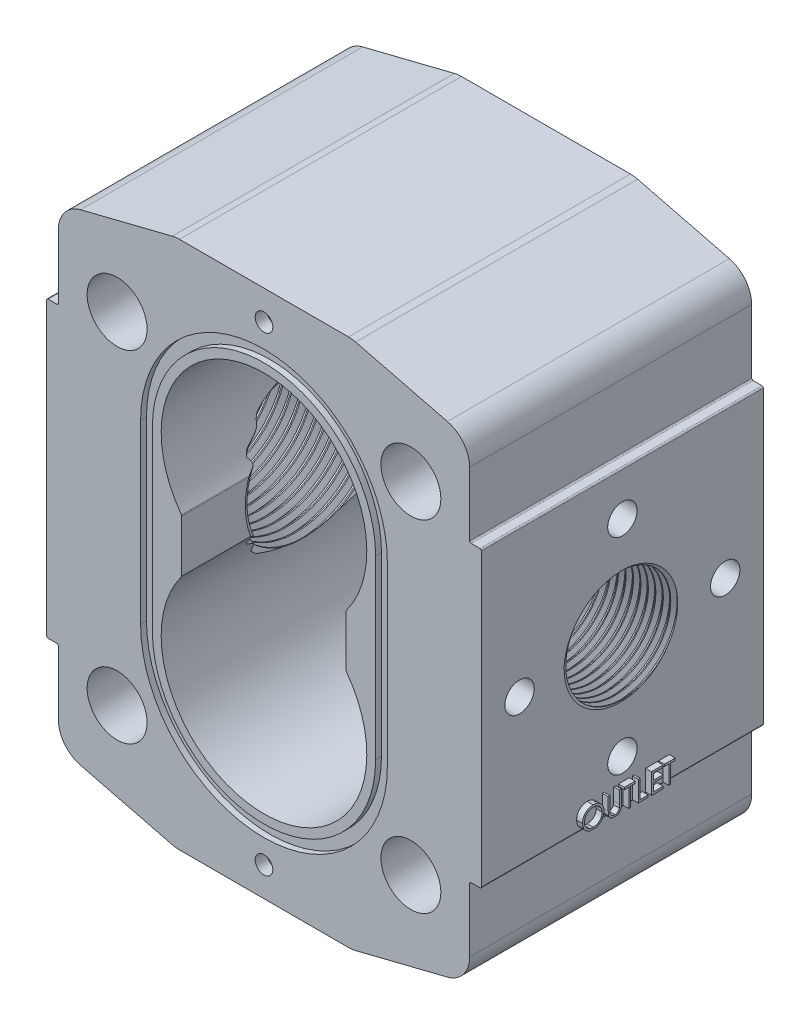
from build123d import *

# Parameters (mm, degrees)
BOSS_EXTRUDE1_DEPTH              = 24
FILLET1_R                        = 5
FILLET2_R                        = 0.25
F_10_2_10_2_DIAMETER_HOLE1_D     = 10.2
F_18_5_18_5_DIAMETER_HOLE1_D     = 18.5
F_18_5_18_5_DIAMETER_HOLE1_DEPTH = 23
F_25_0_25_DIAMETER_HOLE1_D       = 25
F_25_0_25_DIAMETER_HOLE1_DEPTH   = 23
CUT_EXTRUDE_THIN1_DEPTH          = 1
SKETCH10_3_R                     = 1.5
CUT_EXTRUDE1_DEPTH               = 2
WRAP1_DEPTH                      = 1
WRAP2_OUTLINE_W                  = 0.314102564
WRAP2_OUTLINE_H                  = 3.5
WRAP2_DEPTH                      = 1
THREAD1_PITCH                    = 1.27
THREAD2_PITCH                    = 1.5875


# Read off the part's stored shape, not the designer's step: Ø5.0 (5) Diameter Hole1, Wrap1, Wrap2
with BuildPart() as part:
    # Sketch1 → Boss-Extrude1 (new, symmetric)
    with BuildSketch(Plane.XY):
        Polygon((35, -25), (37, -25), (37, 25), (35, 25), (35, 40), (15, 45), (-15, 45), (-35, 40), (-35, 25), (-37, 25), (-37, -25), (-35, -25), (-35, -40), (-15, -45), (15, -45), (35, -40), align=None)
        with BuildLine():
            Line((-14, -4.5), (-14, 4.5))
            ThreePointArc((-14, 4.5), (0, 32.5), (14, 4.5))
            Line((14, 4.5), (14, -4.5))
            ThreePointArc((14, -4.5), (0, -32.5), (-14, -4.5))
        make_face(mode=Mode.SUBTRACT)
    extrude(amount=BOSS_EXTRUDE1_DEPTH, both=True)

    # Fillet1
    fillet1_edges = [part.edges().sort_by_distance(p)[0] for p in [
        (35, -40, 0),
        (15, -45, 0),
        (-15, -45, 0),
        (-35, -40, 0),
        (-35, 40, 0),
        (-15, 45, 0),
        (15, 45, 0),
        (35, 40, 0),
    ]]
    fillet(fillet1_edges, radius=FILLET1_R)

    # Fillet2
    fillet2_edges = [part.edges().sort_by_distance(p)[0] for p in [
        (37, 25, 0),
        (37, -25, 0),
        (35, -25, 0),
        (-35, -25, 0),
        (-37, -25, 0),
        (-37, 25, 0),
        (-35, 25, 0),
        (35, 25, 0),
        (-14, 4.5, 0),
        (14, 4.5, 0),
        (14, -4.5, 0),
        (-14, -4.5, 0),
    ]]
    fillet(fillet2_edges, radius=FILLET2_R)

    # Ø10.2 (10.2) Diameter Hole1 (through all)
    with Locations(Plane.XY.offset(24)):
        with Locations((-25, 29), (25, 29), (25, -29), (-25, -29)):
            Hole(F_10_2_10_2_DIAMETER_HOLE1_D / 2)

    # Ø5.0 (5) Diameter Hole1 outline → Ø5.0 (5) Diameter Hole1 (revolve, cut)
    with BuildSketch(Plane.YX.offset(-17.5)):
        Polygon((0, 37), (0, 27), (2.5, 28.502151548), (2.5, 37), align=None)
    f_5_0_5_diameter_hole1 = revolve(axis=Axis((0, 0, 17.5), (1, 0, 0)), mode=Mode.SUBTRACT)

    # 5.0 _5_ Diameter Hole1 2 outline → 5.0 _5_ Diameter Hole1 2 (revolve, cut)
    with BuildSketch(Plane(origin=(0, 17.5, 0), x_dir=(0, 1, 0), z_dir=(0, 0, -1))):
        Polygon((0, 37), (0, 27), (2.5, 28.502151548), (2.5, 37), align=None)
    f_5_0_5_diameter_hole1_2 = revolve(axis=Axis((0, 17.5, 0), (1, 0, 0)), mode=Mode.SUBTRACT)

    # 5.0 _5_ Diameter Hole1 3 outline → 5.0 _5_ Diameter Hole1 3 (revolve, cut)
    with BuildSketch(Plane.YX.offset(17.5)):
        Polygon((0, 37), (0, 27), (2.5, 28.502151548), (2.5, 37), align=None)
    f_5_0_5_diameter_hole1_3 = revolve(axis=Axis((0, 0, -17.5), (1, 0, 0)), mode=Mode.SUBTRACT)

    # 5.0 _5_ Diameter Hole1 4 outline → 5.0 _5_ Diameter Hole1 4 (revolve, cut)
    with BuildSketch(Plane(origin=(0, -17.5, 0), x_dir=(0, 1, 0), z_dir=(0, 0, -1))):
        Polygon((0, 37), (0, 27), (2.5, 28.502151548), (2.5, 37), align=None)
    f_5_0_5_diameter_hole1_4 = revolve(axis=Axis((0, -17.5, 0), (1, 0, 0)), mode=Mode.SUBTRACT)

    # Ø18.5 (18.5) Diameter Hole1
    with Locations(Plane.YZ.offset(37)):
        with Locations((0, 0)):
            Hole(F_18_5_18_5_DIAMETER_HOLE1_D / 2, depth=F_18_5_18_5_DIAMETER_HOLE1_DEPTH)

    # Ø25.0 (25) Diameter Hole1
    with Locations(Plane.ZY.offset(37)):
        with Locations((0, 0)):
            Hole(F_25_0_25_DIAMETER_HOLE1_D / 2, depth=F_25_0_25_DIAMETER_HOLE1_DEPTH)

    # Mirror1: Ø5.0 (5) Diameter Hole1, 5.0 _5_ Diameter Hole1 2, 5.0 _5_ Diameter Hole1 3, 5.0 _5_ Diameter Hole1 4 across plane
    add(f_5_0_5_diameter_hole1.mirror(Plane(origin=(0, 0, 0), x_dir=(0, 0, 1), z_dir=(1, 0, 0))), mode=Mode.SUBTRACT)
    add(f_5_0_5_diameter_hole1_2.mirror(Plane(origin=(0, 0, 0), x_dir=(0, 0, 1), z_dir=(1, 0, 0))), mode=Mode.SUBTRACT)
    add(f_5_0_5_diameter_hole1_3.mirror(Plane(origin=(0, 0, 0), x_dir=(0, 0, 1), z_dir=(1, 0, 0))), mode=Mode.SUBTRACT)
    add(f_5_0_5_diameter_hole1_4.mirror(Plane(origin=(0, 0, 0), x_dir=(0, 0, 1), z_dir=(1, 0, 0))), mode=Mode.SUBTRACT)

    # Sketch10 → Cut-Extrude-Thin1 (cut)
    with BuildSketch(Plane.XY.offset(24)):
        with BuildLine():
            Line((21, 15), (21, -15))
            ThreePointArc((21, -15), (0, -36), (-21, -15))
            Line((-21, -15), (-21, 15))
            ThreePointArc((-21, 15), (0, 36), (21, 15))
        make_face()
        with BuildLine():
            Line((19, 15), (19, -15))
            ThreePointArc((19, -15), (0, -34), (-19, -15))
            Line((-19, -15), (-19, 15))
            ThreePointArc((-19, 15), (0, 34), (19, 15))
        make_face(mode=Mode.SUBTRACT)
    cut_extrude_thin1 = extrude(amount=-CUT_EXTRUDE_THIN1_DEPTH, mode=Mode.SUBTRACT)

    # Sketch10<3> → Cut-Extrude1 (cut)
    with BuildSketch(Plane.XY.offset(24)):
        with Locations((0, 40)):
            Circle(SKETCH10_3_R)
        with Locations(Location((0, -40, 0), (0, 0, 180))):
            Circle(SKETCH10_3_R)
    cut_extrude1 = extrude(amount=-CUT_EXTRUDE1_DEPTH, mode=Mode.SUBTRACT)

    # Mirror2: Cut-Extrude-Thin1, Cut-Extrude1 across plane
    add(cut_extrude_thin1.mirror(Plane.XY), mode=Mode.SUBTRACT)
    add(cut_extrude1.mirror(Plane.XY), mode=Mode.SUBTRACT)

    # Wrap1 outline → Wrap1 (add)
    # profile 1 of 6: a face of its own
    with BuildSketch(Plane(origin=(37, 0, 0), x_dir=(0, 0, -1), z_dir=(1, 0, 0))):
        with BuildLine():
            add(Edge.make_bspline(
                [(-4.128205128, -22.998597756), (-4.146214493, -22.783332931), (-4.182215554, -22.353014461), (-4.554460876, -21.743273271), (-5.167773034, -21.246562805), (-5.716123192, -21.189031248), (-5.990384615, -21.16025641)],
                knots=[0, 0, 0, 0, 0.220428897, 0.440641545, 0.720232695, 1, 1, 1, 1], degree=3))
            add(Edge.make_bspline(
                [(-5.990384615, -21.16025641), (-6.202587591, -21.181412289), (-6.627026427, -21.223727326), (-7.23171843, -21.590241007), (-7.710726501, -22.205388246), (-7.775365163, -22.74536902), (-7.807692308, -23.015424679)],
                knots=[0, 0, 0, 0, 0.220319519, 0.440673179, 0.720268979, 1, 1, 1, 1], degree=3))
            add(Edge.make_bspline(
                [(-7.807692308, -23.015424679), (-7.755908335, -23.350070613), (-7.670876964, -23.899572725), (-7.140234589, -24.483431158), (-6.752544953, -24.661174467), (-6.558800732, -24.75)],
                knots=[0, 0, 0, 0, 0.437940623, 0.719116155, 1, 1, 1, 1], degree=3))
            Line((-6.558800732, -24.75), (-5.372547444, -24.75))
            add(Edge.make_bspline(
                [(-5.372547444, -24.75), (-5.073423249, -24.589796508), (-4.582568358, -24.326906815), (-4.18483573, -23.640580386), (-4.147087316, -23.212652281), (-4.128205128, -22.998597756)],
                knots=[0, 0, 0, 0, 0.438118142, 0.718940279, 1, 1, 1, 1], degree=3))
        make_face()
        with BuildLine():
            add(Edge.make_bspline(
                [(-5.974959936, -21.519230769), (-5.801087777, -21.536368215), (-5.453216234, -21.570655646), (-4.948847463, -21.849397066), (-4.522950191, -22.33131773), (-4.469190634, -22.775686239), (-4.442307692, -22.997896635)],
                knots=[0, 0, 0, 0, 0.220484161, 0.441129654, 0.72053195, 1, 1, 1, 1], degree=3))
            add(Edge.make_bspline(
                [(-4.442307692, -22.997896635), (-4.458400012, -23.172803057), (-4.490578711, -23.522551327), (-4.79339563, -24.021509922), (-5.30832212, -24.404798431), (-5.752675754, -24.455437474), (-5.974959936, -24.480769231)],
                knots=[0, 0, 0, 0, 0.220346167, 0.440610981, 0.720170331, 1, 1, 1, 1], degree=3))
            add(Edge.make_bspline(
                [(-5.974959936, -24.480769231), (-6.148126777, -24.466558032), (-6.49436589, -24.438143396), (-6.990234844, -24.151542085), (-7.413239581, -23.675907239), (-7.466814168, -23.234586352), (-7.493589744, -23.014022436)],
                knots=[0, 0, 0, 0, 0.220521963, 0.440923494, 0.72058403, 1, 1, 1, 1], degree=3))
            add(Edge.make_bspline(
                [(-7.493589744, -23.014022436), (-7.42323413, -22.66722226), (-7.30747657, -22.096624696), (-6.632603875, -21.60634569), (-6.194149646, -21.548265773), (-5.974959936, -21.519230769)],
                knots=[0, 0, 0, 0, 0.436600851, 0.718348488, 1, 1, 1, 1], degree=3))
        make_face(mode=Mode.SUBTRACT)
    # profile 2 of 6: a face of its own
    with BuildSketch(Plane(origin=(37, 0, 0), x_dir=(0, 0, -1), z_dir=(1, 0, 0))):
        with BuildLine():
            Line((-1.480769231, -21.25), (-1.480769231, -23.347055288))
            add(Edge.make_bspline(
                [(-1.480769231, -23.347055288), (-1.480408624, -23.427156357), (-1.479589764, -23.60904898), (-1.503272823, -23.789461453), (-1.516526442, -23.890424679)],
                knots=[0, 0, 0, 0, 0.440375572, 1, 1, 1, 1], degree=3))
            add(Edge.make_bspline(
                [(-1.516526442, -23.890424679), (-1.5779401, -24.036202146), (-1.71681475, -24.365848605), (-2.072976193, -24.43962083), (-2.271634615, -24.480769231)],
                knots=[0, 0, 0, 0, 0.442223668, 1, 1, 1, 1], degree=3))
            add(Edge.make_bspline(
                [(-2.271634615, -24.480769231), (-2.439979461, -24.453325866), (-2.715562492, -24.408400668), (-3.015417869, -24.133220542), (-3.059859408, -23.919637767), (-3.08213141, -23.81260016)],
                knots=[0, 0, 0, 0, 0.439179343, 0.718943156, 1, 1, 1, 1], degree=3))
            add(Edge.make_bspline(
                [(-3.08213141, -23.81260016), (-3.086673127, -23.744421406), (-3.096998129, -23.589425866), (-3.096456965, -23.434072501), (-3.096153846, -23.347055288)],
                knots=[0, 0, 0, 0, 0.439875587, 1, 1, 1, 1], degree=3))
            Line((-3.096153846, -23.347055288), (-3.096153846, -21.25))
            Line((-3.096153846, -21.25), (-3.41025641, -21.25))
            Line((-3.41025641, -21.25), (-3.41025641, -23.363882212))
            add(Edge.make_bspline(
                [(-3.41025641, -23.363882212), (-3.410259313, -23.472899755), (-3.410265902, -23.720384869), (-3.370247057, -23.964743842), (-3.347856571, -24.10146234)],
                knots=[0, 0, 0, 0, 0.440501419, 1, 1, 1, 1], degree=3))
            add(Edge.make_bspline(
                [(-3.347856571, -24.10146234), (-3.295315608, -24.227818542), (-3.176089385, -24.514546689), (-2.901665215, -24.665544402), (-2.748175094, -24.75)],
                knots=[0, 0, 0, 0, 0.440682938, 1, 1, 1, 1], degree=3))
            Line((-2.748175094, -24.75), (-1.811583713, -24.75))
            add(Edge.make_bspline(
                [(-1.811583713, -24.75), (-1.613372069, -24.605339259), (-1.287236407, -24.367315772), (-1.180035847, -23.815751804), (-1.171128463, -23.514688016), (-1.166666667, -23.363882212)],
                knots=[0, 0, 0, 0, 0.436084207, 0.717529047, 1, 1, 1, 1], degree=3))
            Line((-1.166666667, -23.363882212), (-1.166666667, -21.25))
            Line((-1.166666667, -21.25), (-1.480769231, -21.25))
        make_face()
    # profile 3 of 6: a face of its own
    with BuildSketch(Plane(origin=(37, 0, 0), x_dir=(0, 0, -1), z_dir=(1, 0, 0))):
        Polygon((0.08974359, -24.75), (0.403846154, -24.75), (0.403846154, -21.608974359), (1.166666667, -21.608974359), (1.166666667, -21.25), (-0.673076923, -21.25), (-0.673076923, -21.608974359), (0.08974359, -21.608974359), align=None)
    # profile 4 of 6: a face of its own
    with BuildSketch(Plane(origin=(37, 0, 0), x_dir=(0, 0, -1), z_dir=(1, 0, 0))):
        Polygon((1.705128205, -24.75), (3.365384615, -24.75), (3.365384615, -24.391025641), (2.019230769, -24.391025641), (2.019230769, -21.25), (1.705128205, -21.25), align=None)
    # profile 5 of 6: a face of its own
    with BuildSketch(Plane(origin=(37, 0, 0), x_dir=(0, 0, -1), z_dir=(1, 0, 0))):
        Polygon((3.948717949, -24.75), (5.923076923, -24.75), (5.923076923, -24.391025641), (4.262820513, -24.391025641), (4.262820513, -23.044871795), (5.923076923, -23.044871795), (5.923076923, -22.685897436), (4.262820513, -22.685897436), (4.262820513, -21.608974359), (5.923076923, -21.608974359), (5.923076923, -21.25), (3.948717949, -21.25), align=None)
    # profile 6 of 6: a face of its own
    with BuildSketch(Plane(origin=(37, 0, 0), x_dir=(0, 0, -1), z_dir=(1, 0, 0))):
        Polygon((6.91025641, -24.75), (7.224358974, -24.75), (7.224358974, -21.608974359), (7.987179487, -21.608974359), (7.987179487, -21.25), (6.147435897, -21.25), (6.147435897, -21.608974359), (6.91025641, -21.608974359), align=None)
    extrude(amount=WRAP1_DEPTH)

    # Wrap2 outline → Wrap2 (add)
    with BuildSketch(Plane.ZY.offset(37)):
        with Locations((-5.205128205, -23)):
            Rectangle(WRAP2_OUTLINE_W, WRAP2_OUTLINE_H)
        Polygon((-4.150641026, -21.25), (-4.150641026, -24.75), (-3.836538462, -24.75), (-3.836538462, -22.001602564), (-1.529847756, -24.75), (-1.458333333, -24.75), (-1.458333333, -21.25), (-1.772435897, -21.25), (-1.772435897, -24.004707532), (-4.084735577, -21.25), align=None)
        Polygon((-0.560897436, -21.25), (-0.560897436, -24.75), (1.099358974, -24.75), (1.099358974, -24.391025641), (-0.246794872, -24.391025641), (-0.246794872, -21.25), align=None)
        Polygon((1.682692308, -21.25), (1.682692308, -24.75), (3.657051282, -24.75), (3.657051282, -24.391025641), (1.996794872, -24.391025641), (1.996794872, -23.044871795), (3.657051282, -23.044871795), (3.657051282, -22.685897436), (1.996794872, -22.685897436), (1.996794872, -21.608974359), (3.657051282, -21.608974359), (3.657051282, -21.25), align=None)
        Polygon((4.644230769, -21.608974359), (4.644230769, -24.75), (4.958333333, -24.75), (4.958333333, -21.608974359), (5.721153846, -21.608974359), (5.721153846, -21.25), (3.881410256, -21.25), (3.881410256, -21.608974359), align=None)
    extrude(amount=WRAP2_DEPTH)

    # Thread1: the profile of Thread Profile2 profile screwed along a right-hand helix of 19.685039 turns, 8 arcs to a turn; built about Z, then put on its axis
    thread1_z = Axis((0, 0, 0), (0, 0, 1))
    thread1_corners = [(9.2497, 0, -0.000173205), (9.2497, 0, 1.111423202), (9.937407661, 0, 0.714374998), (9.937407661, 0, 0.396874998)]
    with BuildLine(mode=Mode.PRIVATE) as thread1_profile:
        Line(thread1_corners[0], thread1_corners[1])
        Line(thread1_corners[1], thread1_corners[2])
        Line(thread1_corners[2], thread1_corners[3])
        Line(thread1_corners[3], thread1_corners[0])
    thread1_cap = Face(thread1_profile.wire())
    thread1_turn_angles = [0, 22.5, 45, 67.5, 90, 112.5, 135, 157.5, 180, 202.5, 225, 247.5, 270, 292.5, 315, 337.5, 360]
    thread1_turn_weights = [1, 0.9238795325112867, 1, 0.9238795325112867, 1, 0.9238795325112867, 1, 0.9238795325112867, 1, 0.9238795325112867, 1, 0.9238795325112867, 1, 0.9238795325112867, 1, 0.9238795325112867, 1]
    thread1_turn_rails = [Edge.make_bspline([Vector(p[0], p[1], 0).rotate(thread1_z, thread1_turn_angles[k]) / thread1_turn_weights[k] + Vector(0, 0, p[2] + THREAD1_PITCH * thread1_turn_angles[k] / 360) for k in range(17)], [0, 0, 0, 1, 1, 2, 2, 3, 3, 4, 4, 5, 5, 6, 6, 7, 7, 8, 8, 8], 2, thread1_turn_weights) for p in thread1_corners]
    thread1_turn_sides = [Face.make_surface_from_curves(thread1_turn_rails[p[0]], thread1_turn_rails[p[1]]) for p in [(0, 1), (1, 2), (2, 3), (3, 0)]]
    thread1_last_angles = [6840, 6862.5, 6885, 6907.5, 6930, 6952.5, 6975, 6997.5, 7020, 7042.5, 7065, 7075.807086614, 7086.614173228]
    thread1_last_weights = [1, 0.9238795325112867, 1, 0.9238795325112867, 1, 0.9238795325112867, 1, 0.9238795325112867, 1, 0.9238795325112867, 1, 0.982264067004197, 1]
    thread1_last_rails = [Edge.make_bspline([Vector(p[0], p[1], 0).rotate(thread1_z, thread1_last_angles[k]) / thread1_last_weights[k] + Vector(0, 0, p[2] + THREAD1_PITCH * thread1_last_angles[k] / 360) for k in range(13)], [0, 0, 0, 1, 1, 2, 2, 3, 3, 4, 4, 5, 5, 6, 6, 6], 2, thread1_last_weights) for p in thread1_corners]
    thread1_last_sides = [Face.make_surface_from_curves(thread1_last_rails[p[0]], thread1_last_rails[p[1]]) for p in [(0, 1), (1, 2), (2, 3), (3, 0)]]
    thread1 = Plane(origin=(39, 0, 0), x_dir=(0, 0, 1), z_dir=(-1, 0, 0)) * Solid(Shell([*[p.moved(Location((0, 0, THREAD1_PITCH * i))) for i in range(19) for p in thread1_turn_sides], *thread1_last_sides, thread1_cap, thread1_cap.rotate(thread1_z, 7086.614173228).moved(Location((0, 0, THREAD1_PITCH * 7086.614173228 / 360)))]))
    add(thread1, mode=Mode.SUBTRACT)

    # Thread2: the profile of Thread Profile3 profile screwed along a right-hand helix of 15.748031 turns, 8 arcs to a turn; built about Z, then put on its axis
    thread2_z = Axis((0, 0, 0), (0, 0, 1))
    thread2_corners = [(12.4997, 0, -0.000173205), (12.4997, 0, 1.389235701), (13.359259577, 0, 0.892968748), (13.359259577, 0, 0.496093748)]
    with BuildLine(mode=Mode.PRIVATE) as thread2_profile:
        Line(thread2_corners[0], thread2_corners[1])
        Line(thread2_corners[1], thread2_corners[2])
        Line(thread2_corners[2], thread2_corners[3])
        Line(thread2_corners[3], thread2_corners[0])
    thread2_cap = Face(thread2_profile.wire())
    thread2_turn_angles = [0, 22.5, 45, 67.5, 90, 112.5, 135, 157.5, 180, 202.5, 225, 247.5, 270, 292.5, 315, 337.5, 360]
    thread2_turn_weights = [1, 0.9238795325112867, 1, 0.9238795325112867, 1, 0.9238795325112867, 1, 0.9238795325112867, 1, 0.9238795325112867, 1, 0.9238795325112867, 1, 0.9238795325112867, 1, 0.9238795325112867, 1]
    thread2_turn_rails = [Edge.make_bspline([Vector(p[0], p[1], 0).rotate(thread2_z, thread2_turn_angles[k]) / thread2_turn_weights[k] + Vector(0, 0, p[2] + THREAD2_PITCH * thread2_turn_angles[k] / 360) for k in range(17)], [0, 0, 0, 1, 1, 2, 2, 3, 3, 4, 4, 5, 5, 6, 6, 7, 7, 8, 8, 8], 2, thread2_turn_weights) for p in thread2_corners]
    thread2_turn_sides = [Face.make_surface_from_curves(thread2_turn_rails[p[0]], thread2_turn_rails[p[1]]) for p in [(0, 1), (1, 2), (2, 3), (3, 0)]]
    thread2_last_angles = [5400, 5422.5, 5445, 5467.5, 5490, 5512.5, 5535, 5557.5, 5580, 5602.5, 5625, 5647.145669291, 5669.291338583]
    thread2_last_weights = [1, 0.9238795325112867, 1, 0.9238795325112867, 1, 0.9238795325112867, 1, 0.9238795325112867, 1, 0.9238795325112867, 1, 0.926228455927339, 1]
    thread2_last_rails = [Edge.make_bspline([Vector(p[0], p[1], 0).rotate(thread2_z, thread2_last_angles[k]) / thread2_last_weights[k] + Vector(0, 0, p[2] + THREAD2_PITCH * thread2_last_angles[k] / 360) for k in range(13)], [0, 0, 0, 1, 1, 2, 2, 3, 3, 4, 4, 5, 5, 6, 6, 6], 2, thread2_last_weights) for p in thread2_corners]
    thread2_last_sides = [Face.make_surface_from_curves(thread2_last_rails[p[0]], thread2_last_rails[p[1]]) for p in [(0, 1), (1, 2), (2, 3), (3, 0)]]
    thread2 = Plane(origin=(-39, 0, 0), x_dir=(0, 0, -1), z_dir=(1, 0, 0)) * Solid(Shell([*[p.moved(Location((0, 0, THREAD2_PITCH * i))) for i in range(15) for p in thread2_turn_sides], *thread2_last_sides, thread2_cap, thread2_cap.rotate(thread2_z, 5669.291338583).moved(Location((0, 0, THREAD2_PITCH * 5669.291338583 / 360)))]))
    add(thread2, mode=Mode.SUBTRACT)


solid = part.part
